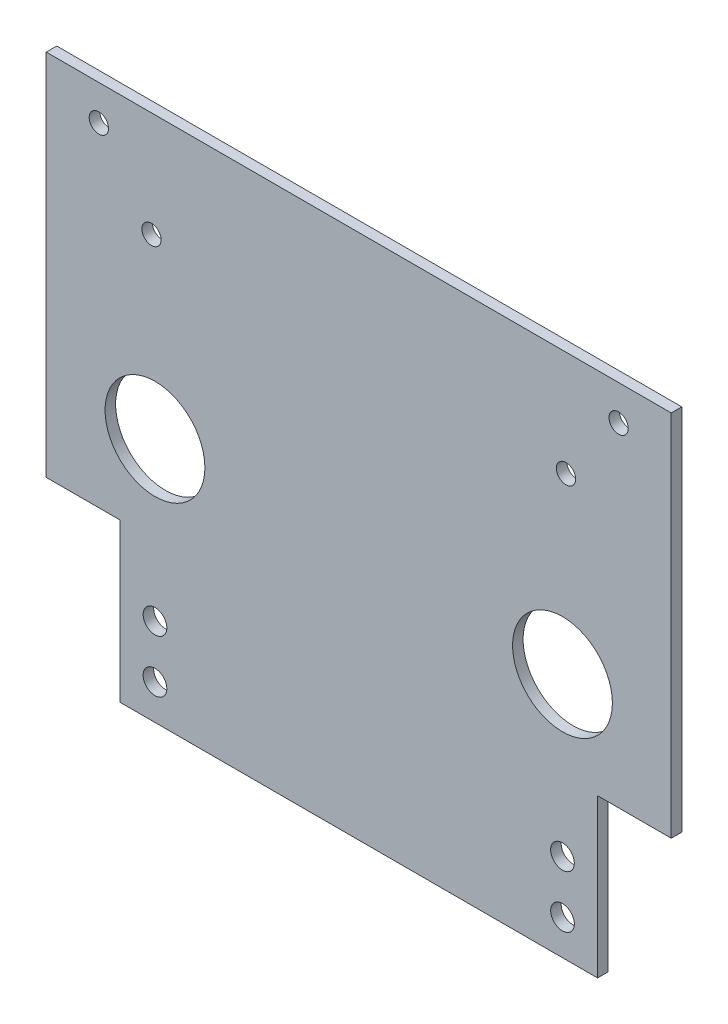
from build123d import *

# Parameters (mm, degrees)
SKETCH1_W           = 178.16
SKETCH1_H           = 150
BOSS_EXTRUDE1_DEPTH = 3
SKETCH2_R           = 14.225
SKETCH2_R_2         = 3.375
CUT_EXTRUDE1_DEPTH  = 233.916263065
SKETCH4_W           = 21
SKETCH4_H           = 45
CUT_EXTRUDE3_DEPTH  = 233.916263065
SKETCH5_R           = 2.75
CUT_EXTRUDE4_DEPTH  = 233.916263065


with BuildPart() as part:
    # Sketch1 → Boss-Extrude1 (new body)
    with BuildSketch(Plane.XY):
        with Locations((89.08, -75)):
            Rectangle(SKETCH1_W, SKETCH1_H)
    extrude(amount=BOSS_EXTRUDE1_DEPTH)

    # Sketch2 → Cut-Extrude1 (cut, through all)
    with BuildSketch(Plane.XY.offset(3)):
        with Locations((31, -80)):
            Circle(SKETCH2_R)
        with Locations((147.16, -80)):
            Circle(SKETCH2_R)
        with Locations((31, -140)):
            Circle(SKETCH2_R_2)
        with Locations((147.16, -140)):
            Circle(SKETCH2_R_2)
        with Locations((31, -125)):
            Circle(SKETCH2_R_2)
        with Locations((147.16, -125)):
            Circle(SKETCH2_R_2)
    extrude(amount=-CUT_EXTRUDE1_DEPTH, mode=Mode.SUBTRACT)

    # Sketch4 → Cut-Extrude3 (cut, through all)
    with BuildSketch(Plane.XY.offset(3)):
        with Locations((10.5, -127.5)):
            Rectangle(SKETCH4_W, SKETCH4_H)
        with Locations((167.66, -127.5)):
            Rectangle(SKETCH4_W, SKETCH4_H)
    extrude(amount=-CUT_EXTRUDE3_DEPTH, mode=Mode.SUBTRACT)

    # Sketch5 → Cut-Extrude4 (cut, through all)
    with BuildSketch(Plane.XY.offset(3)):
        with Locations((163.16, -10)):
            Circle(SKETCH5_R)
        with Locations((15, -10)):
            Circle(SKETCH5_R)
        with Locations((148.16, -30)):
            Circle(SKETCH5_R)
        with Locations((30, -30)):
            Circle(SKETCH5_R)
    extrude(amount=-CUT_EXTRUDE4_DEPTH, mode=Mode.SUBTRACT)


solid = part.part
